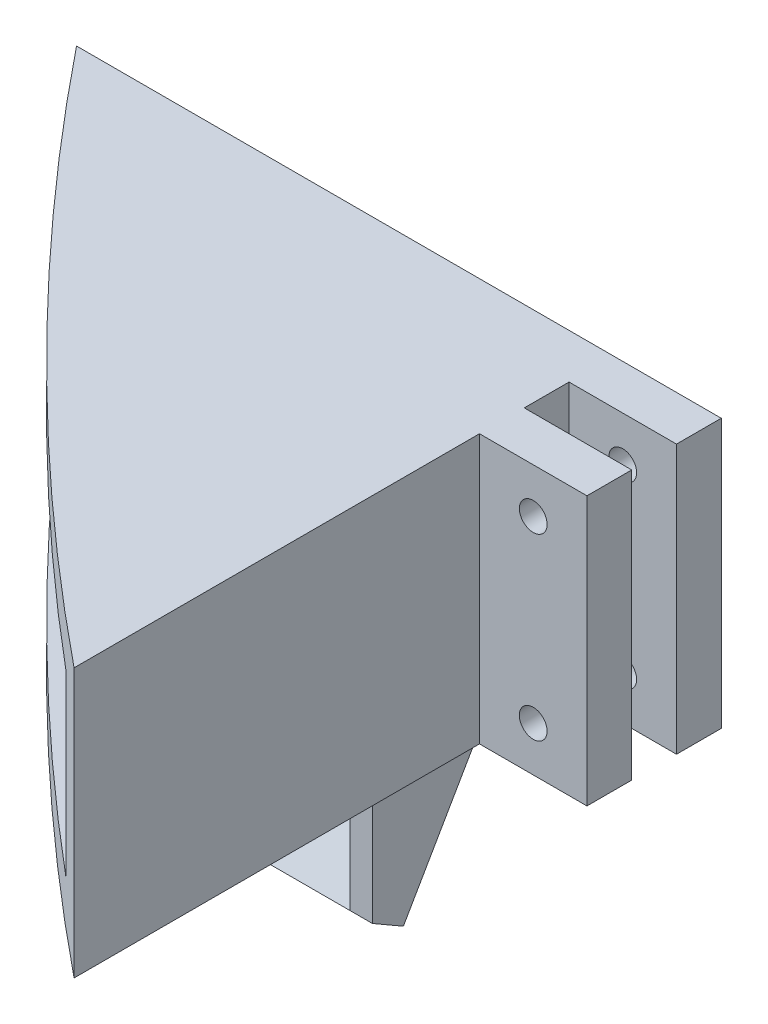
from build123d import *

# Parameters (mm, degrees)
EXTRUDE_1_DEPTH          = 30
CUT_EXTRUDE_1_DEPTH      = 98.124713642
CUT_EXTRUDE_1_DEPTH_BACK = 98.124713642
SKETCH_2_R               = 1.55
CUT_EXTRUDE_6_DEPTH      = 10
EXTRUDE_3_DEPTH          = 12.5
SKETCH_12_W              = 5
SKETCH_12_H              = 30
EXTRUDE_4_DEPTH          = 2
SKETCH_24_W              = 22
SKETCH_24_H              = 27
SKETCH_24_R              = 1.55
EXTRUDE_8_DEPTH          = 4
EXTRUDE_9_DEPTH          = 2.5
EXTRUDE_10_DEPTH         = 2.5


with BuildPart() as part:
    # 草图1 → 凸台-拉伸1 (new body)
    with BuildSketch(Plane(origin=(0, 0, 0), x_dir=(1, 0, 0), z_dir=(0, 1, 0))):
        with BuildLine():
            Line((0, 0), (-70, 0))
            ThreePointArc((-70, 0), (-41.606545869, -31.737243891), (-10, -60.276114672))
            Line((-10, -60.276114672), (-10, -15))
            Line((-10, -15), (0, -15))
            Line((0, -15), (0, -10))
            Line((0, -10), (-10, -10))
            Line((-10, -10), (-10, -5))
            Line((-10, -5), (0, -5))
            Line((0, -5), (0, 0))
        make_face()
    extrude(amount=EXTRUDE_1_DEPTH)

    # 草图2 → 切除-拉伸1 (cut, two sides: drawn at the far end of the back side and taken through both)
    with BuildSketch(Plane(origin=(0, 0, 0), x_dir=(-1, 0, 0), z_dir=(0, 0, -1)).offset(-CUT_EXTRUDE_1_DEPTH_BACK)):
        with Locations((4, 25)):
            Circle(SKETCH_2_R)
        with Locations((4, 5)):
            Circle(SKETCH_2_R)
    extrude(amount=CUT_EXTRUDE_1_DEPTH + CUT_EXTRUDE_1_DEPTH_BACK, mode=Mode.SUBTRACT)

    # 草图9 → 切除-拉伸6 (cut, symmetric)
    with BuildSketch(Plane(origin=(0, 15, 0), x_dir=(1, 0, 0), z_dir=(0, 1, 0))):
        with BuildLine():
            Line((-65.918016471, -5), (-59.391772218, -5))
            Line((-59.391772218, -5), (-15, -5))
            Line((-15, -5), (-15, -15))
            Line((-15, -15), (-15, -49.60330608))
            Line((-15, -49.60330608), (-15, -56.155472209))
            ThreePointArc((-15, -56.155472209), (-41.615194331, -31.728555364), (-65.918016471, -5))
        make_face()
    extrude(amount=CUT_EXTRUDE_6_DEPTH, both=True, mode=Mode.SUBTRACT)

    # 草图11 → 凸台-拉伸3 (add, symmetric)
    with BuildSketch(Plane(origin=(0, 15, 0), x_dir=(1, 0, 0), z_dir=(0, 1, 0))):
        Polygon((-15, -5), (-23, -5), (-15, -10), align=None)
    extrude(amount=EXTRUDE_3_DEPTH, both=True)

    # 草图12 → 凸台-拉伸4 (add)
    with BuildSketch(Plane(origin=(0, 0, 0), x_dir=(0, 0, -1), z_dir=(1, 0, 0))):
        with Locations((-12.5, 15)):
            Rectangle(SKETCH_12_W, SKETCH_12_H)
        with Locations((-2.5, 15)):
            Rectangle(SKETCH_12_W, SKETCH_12_H)
    extrude(amount=EXTRUDE_4_DEPTH)

    # 草图24 → 凸台-拉伸8 (add)
    with BuildSketch(Plane(origin=(0, 0, 0), x_dir=(-1, 0, 0), z_dir=(0, -0.500000000000001, -0.866025403784438))):
        with Locations((31, -13.5)):
            Rectangle(SKETCH_24_W, SKETCH_24_H)
        with Locations((28, -15)):
            Circle(SKETCH_24_R, mode=Mode.SUBTRACT)
        with Locations((33, -23.660254038)):
            Circle(SKETCH_24_R, mode=Mode.SUBTRACT)
        with Locations((36.660254038, -20)):
            Circle(SKETCH_24_R, mode=Mode.SUBTRACT)
        with Locations((38, -15)):
            Circle(SKETCH_24_R, mode=Mode.SUBTRACT)
        with Locations((36.660254038, -10)):
            Circle(SKETCH_24_R, mode=Mode.SUBTRACT)
        with Locations((33, -6.339745962)):
            Circle(SKETCH_24_R, mode=Mode.SUBTRACT)
    extrude(amount=-EXTRUDE_8_DEPTH)

    # 草图25 → 凸台-拉伸9 (add)
    with BuildSketch(Plane(origin=(-20, 0, 0), x_dir=(0, 0, -1), z_dir=(1, 0, 0))):
        Polygon((-16.964101615, -21.382685902), (-16.964101615, 0), (-4.618802154, 0), align=None)
    extrude(amount=-EXTRUDE_9_DEPTH)

    # 草图27 → 凸台-拉伸10 (add)
    with BuildSketch(Plane.ZY.offset(42)):
        Polygon((0, 0), (16.964101615, 0), (16.964101615, -21.382685902), (13.5, -23.382685902), align=None)
    extrude(amount=EXTRUDE_10_DEPTH)


solid = part.part
